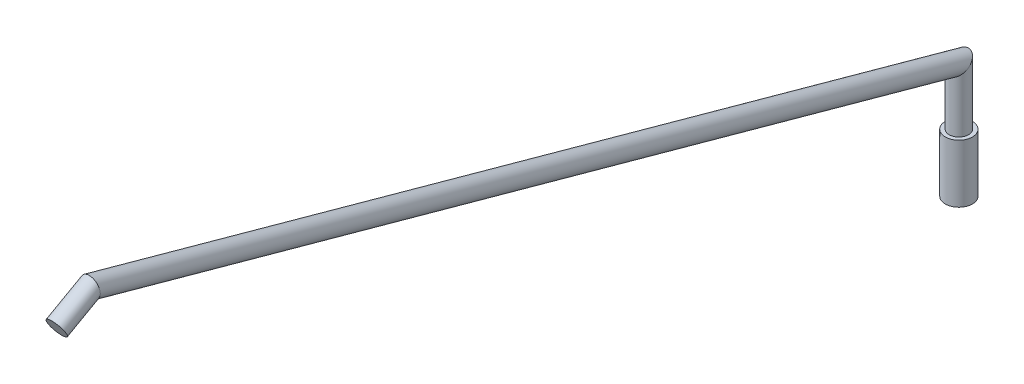
from build123d import *

# Parameters (mm, degrees)
SKETCH2_R           = 2.5
SKETCH3_R           = 3.5
BOSS_EXTRUDE1_DEPTH = 15


with BuildPart() as part:
    # Sweep1: sweep along a path in Sketch1
    with BuildLine(Plane(origin=(0, 0, 0), x_dir=(0, 0, -1), z_dir=(1, 0, 0))) as sweep1_path:
        Line((0, 0), (0, 30))
        Line((0, 30), (-224.277396019, 91.890417139))
        Line((-224.277396019, 91.890417139), (-233, 87))
    # Sketch2 → Sweep1 (sweep)
    with BuildSketch(Plane(origin=(0, 87, 233), x_dir=(1, 0, 0), z_dir=(0, -0.48904171388526047, 0.8722603980923169))):
        Circle(SKETCH2_R)
    sweep(path=sweep1_path.line, transition=Transition.RIGHT)

    # Sketch3 → Boss-Extrude1 (add)
    with BuildSketch(Plane.XZ):
        Circle(SKETCH3_R)
    extrude(amount=-BOSS_EXTRUDE1_DEPTH)


solid = part.part
